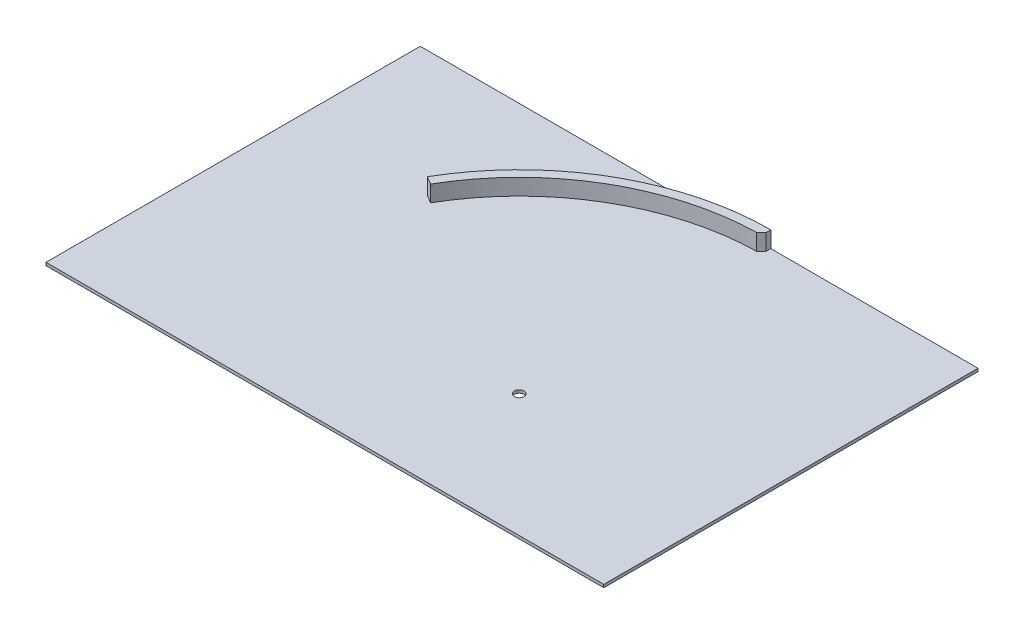
from build123d import *

# Parameters (mm, degrees)
BOSS_EXTRUDE1_DEPTH    = 35
SKETCH4_W              = 1200
SKETCH4_H              = 805.2
BOSS_EXTRUDE2_DEPTH    = 6.35
CHAMFER1_SIZE          = 10
F_20_0MM_DOWEL_HOLE1_D = 21


with BuildPart() as part:
    # Sketch3 → Boss-Extrude1 (new body)
    with BuildSketch(Plane(origin=(0, 0, 0), x_dir=(1, 0, 0), z_dir=(0, 1, 0))):
        with BuildLine():
            Line((0, 541), (0, 521))
            ThreePointArc((0, 521), (-260.5, 451.199235372), (-451.199235372, 260.5))
            Line((-451.199235372, 260.5), (-468.519743447, 270.5))
            ThreePointArc((-468.519743447, 270.5), (-270.5, 468.519743447), (0, 541))
        make_face()
    extrude(amount=BOSS_EXTRUDE1_DEPTH)

    # Sketch4 → Boss-Extrude2 (add)
    with BuildSketch(Plane(origin=(0, 0, 0), x_dir=(1, 0, 0), z_dir=(0, 1, 0))):
        with Locations((-154.139235372, 138.4)):
            Rectangle(SKETCH4_W, SKETCH4_H)
    extrude(amount=-BOSS_EXTRUDE2_DEPTH)

    # Chamfer1
    # the kernel refuses this chamfer: 10 mm, written as the material it takes off along each edge
    with BuildSketch(Plane(origin=(0, 0, -521), x_dir=(-0.999953038196086, 0, 0.009691305506332204), z_dir=(0, 1, 0))) as chamfer1_piece_1:
        with BuildLine():
            Line((10.098340338, 0), (-CHAMFER1_SIZE * 0.00969130550633, -CHAMFER1_SIZE * 0.999953038196))
            Line((-CHAMFER1_SIZE * 0.00969130550633, -CHAMFER1_SIZE * 0.999953038196), (0, 0))
            ThreePointArc((0, 0), (5.192000536, -0.024447522), (10.098340338, 0))
        make_face()
    extrude(amount=60.969219121, mode=Mode.SUBTRACT)

    # Ø20.0mm Dowel Hole1 (through all)
    with Locations(Plane(origin=(0, 0, 0), x_dir=(1, 0, 0), z_dir=(0, 1, 0))):
        with Locations((0, 0)):
            Hole(F_20_0MM_DOWEL_HOLE1_D / 2)


solid = part.part
